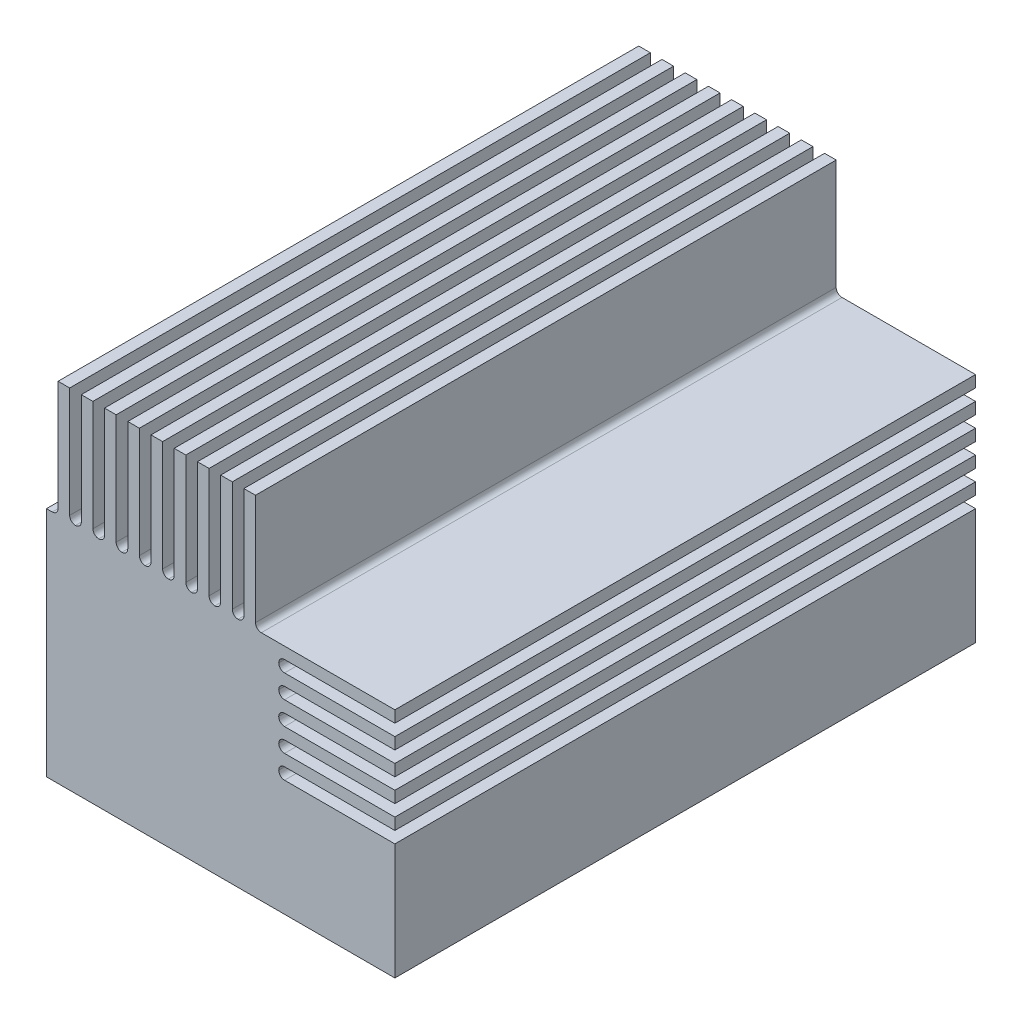
from build123d import *

# Parameters (mm, degrees)
SKETCH1_W           = 100
SKETCH1_H           = 250
BOSS_EXTRUDE1_DEPTH = 100
SKETCH2_W           = 50
SKETCH2_H           = 5
SKETCH2_W_2         = 5
SKETCH2_H_2         = 50
BOSS_EXTRUDE2_DEPTH = 250
FILLET3_R           = 2.5
FILLET4_R           = 2.5


with BuildPart() as part:
    # Sketch1 → Boss-Extrude1 (new body)
    with BuildSketch(Plane(origin=(0, 0, 0), x_dir=(1, 0, 0), z_dir=(0, 1, 0))):
        with Locations((50, 125)):
            Rectangle(SKETCH1_W, SKETCH1_H)
    extrude(amount=BOSS_EXTRUDE1_DEPTH)

    # Sketch2 → Boss-Extrude2 (add)
    with BuildSketch(Plane.XY):
        with Locations((125, 87.5)):
            Rectangle(SKETCH2_W, SKETCH2_H)
        with Locations((125, 97.5)):
            Rectangle(SKETCH2_W, SKETCH2_H)
        with Locations((125, 77.5)):
            Rectangle(SKETCH2_W, SKETCH2_H)
        with Locations((125, 67.5)):
            Rectangle(SKETCH2_W, SKETCH2_H)
        with Locations((17.5, 125)):
            Rectangle(SKETCH2_W_2, SKETCH2_H_2)
        with Locations((7.5, 125)):
            Rectangle(SKETCH2_W_2, SKETCH2_H_2)
        with Locations((27.5, 125)):
            Rectangle(SKETCH2_W_2, SKETCH2_H_2)
        with Locations((37.5, 125)):
            Rectangle(SKETCH2_W_2, SKETCH2_H_2)
        with Locations((47.5, 125)):
            Rectangle(SKETCH2_W_2, SKETCH2_H_2)
        with Locations((57.5, 125)):
            Rectangle(SKETCH2_W_2, SKETCH2_H_2)
        with Locations((67.5, 125)):
            Rectangle(SKETCH2_W_2, SKETCH2_H_2)
        with Locations((77.5, 125)):
            Rectangle(SKETCH2_W_2, SKETCH2_H_2)
        with Locations((87.5, 125)):
            Rectangle(SKETCH2_W_2, SKETCH2_H_2)
        with Locations((125, 25)):
            Rectangle(SKETCH2_W, SKETCH2_H_2)
        with Locations((125, 57.5)):
            Rectangle(SKETCH2_W, SKETCH2_H)
    extrude(amount=-BOSS_EXTRUDE2_DEPTH)

    # Fillet3
    fillet3_edges = [part.edges().sort_by_distance(p)[0] for p in [
        (80, 100, -125),
        (75, 100, -125),
        (90, 100, -125),
        (85, 100, -125),
        (5, 100, -125),
        (10, 100, -125),
        (20, 100, -125),
        (15, 100, -125),
        (30, 100, -125),
        (25, 100, -125),
        (40, 100, -125),
        (35, 100, -125),
        (50, 100, -125),
        (45, 100, -125),
        (60, 100, -125),
        (55, 100, -125),
        (70, 100, -125),
        (65, 100, -125),
    ]]
    fillet(fillet3_edges, radius=FILLET3_R - 0.0001)  # a hair under: the kernel refuses the full size

    # Fillet4
    fillet4_edges = [part.edges().sort_by_distance(p)[0] for p in [
        (100, 55, -125),
        (100, 65, -125),
        (100, 75, -125),
        (100, 85, -125),
        (100, 95, -125),
        (100, 90, -125),
        (100, 80, -125),
        (100, 70, -125),
        (100, 60, -125),
        (100, 50, -125),
    ]]
    fillet(fillet4_edges, radius=FILLET4_R - 0.0001)  # a hair under: the kernel refuses the full size


solid = part.part
